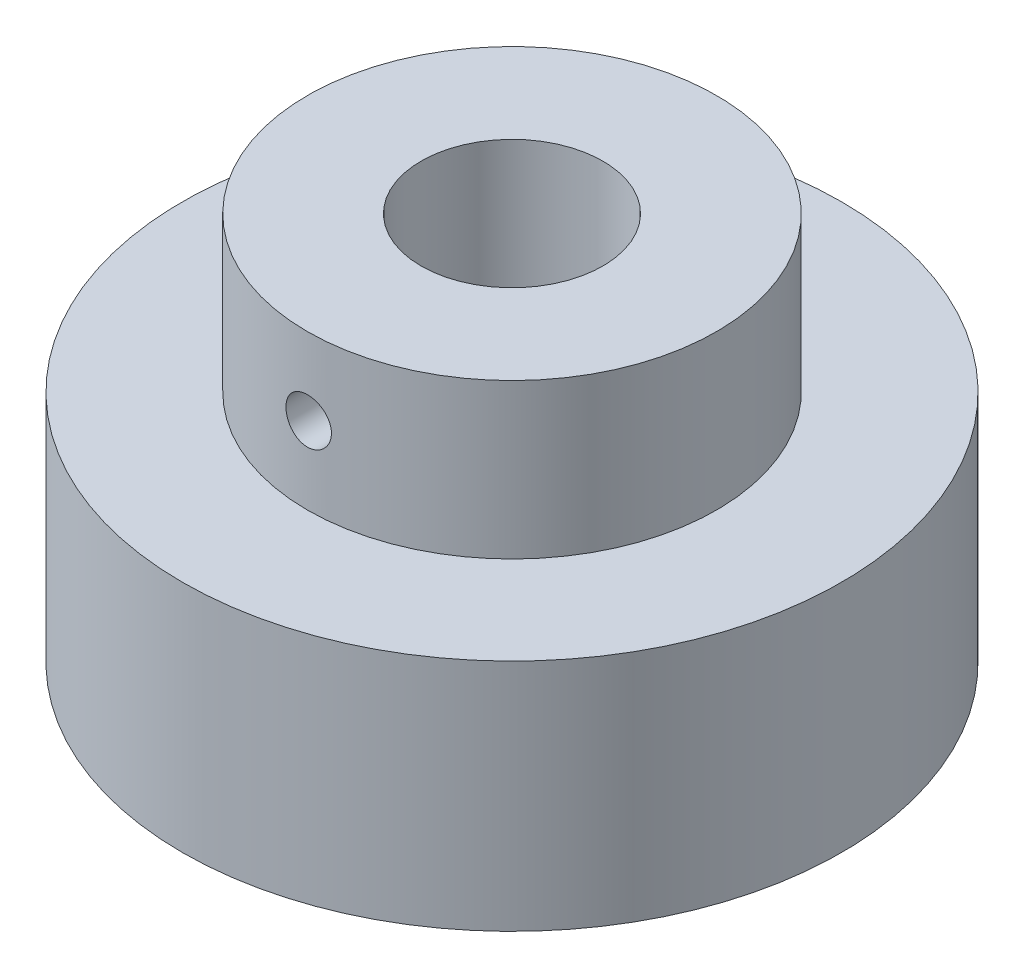
from build123d import *

# Parameters (mm, degrees)
SKETCH_1_R          = 14.5
SKETCH_1_R_2        = 4
EXTRUDE_1_DEPTH     = 10.3
SKETCH_2_R          = 9
SKETCH_2_R_2        = 4
EXTRUDE_2_DEPTH     = 6.8
CUT_EXTRUDE_1_REACH = 28.7
SKETCH_3_R          = 1


with BuildPart() as part:
    # 草圖1 → 填料-伸長1 (new body)
    with BuildSketch(Plane(origin=(0, 0, 0), x_dir=(1, 0, 0), z_dir=(0, 1, 0))):
        Circle(SKETCH_1_R)
        Circle(SKETCH_1_R_2, mode=Mode.SUBTRACT)
    extrude(amount=EXTRUDE_1_DEPTH)

    # 草圖2 → 填料-伸長2 (add)
    with BuildSketch(Plane(origin=(0, 10.3, 0), x_dir=(1, 0, 0), z_dir=(0, 1, 0))):
        Circle(SKETCH_2_R)
        Circle(SKETCH_2_R_2, mode=Mode.SUBTRACT)
    extrude(amount=EXTRUDE_2_DEPTH)

    # 草圖3 → 除料-伸長1 (cut, up to next)
    with BuildSketch(Plane.XY, mode=Mode.PRIVATE) as cut_extrude_1_sk1:
        with Locations((0, 13.7)):
            Circle(SKETCH_3_R)
    cut_extrude_1_tool1 = extrude(cut_extrude_1_sk1.sketch, amount=CUT_EXTRUDE_1_REACH, mode=Mode.PRIVATE) & part.part
    add(cut_extrude_1_tool1.solids().sort_by_distance((0, 13.7, 0))[0], mode=Mode.SUBTRACT)


solid = part.part
